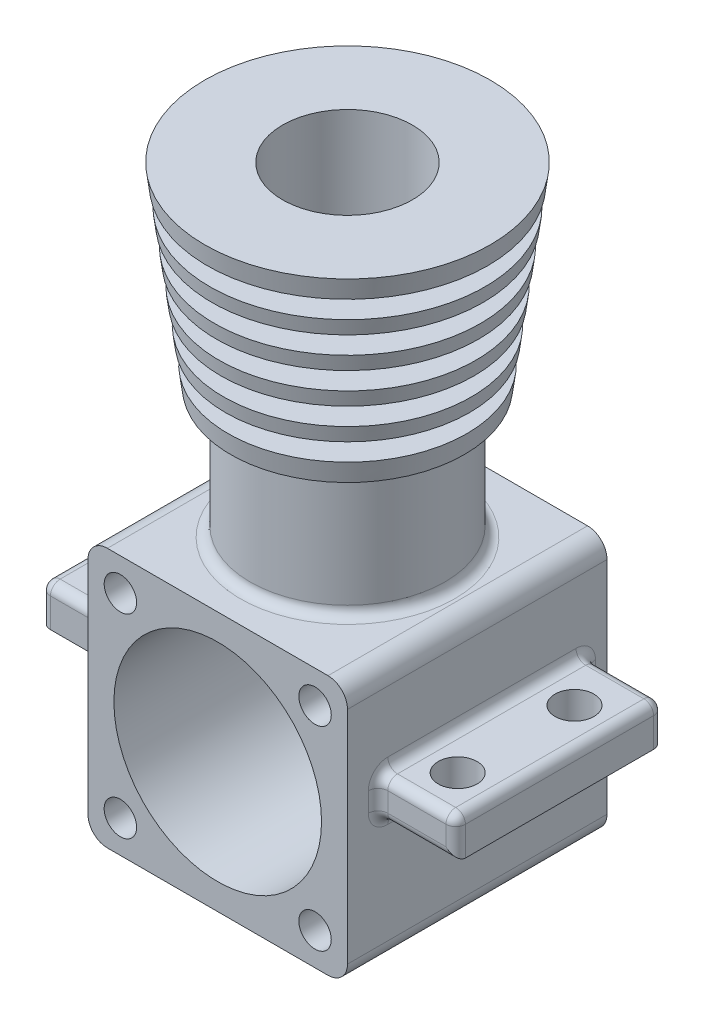
from build123d import *

# Parameters (mm, degrees)
SKETCH1_W           = 40
SKETCH1_H           = 40
SKETCH1_R           = 2.5
SKETCH1_R_2         = 16
BOSS_EXTRUDE1_DEPTH = 20
FILLET2_R           = 3
SKETCH7_W           = 18
SKETCH7_H           = 3
LPATTERN1_COUNT     = 5
LPATTERN1_PITCH     = 5.25
SKETCH8_R           = 10
CUT_EXTRUDE1_DEPTH  = 70
SKETCH10_W          = 12
SKETCH10_H          = 32
SKETCH10_R          = 3
BOSS_EXTRUDE2_DEPTH = 6
FILLET4_R           = 1.5


with BuildPart() as part:
    # Sketch1 → Boss-Extrude1 (new, symmetric)
    with BuildSketch(Plane.XY):
        with Locations((0.017734769, -0.034630907)):
            Rectangle(SKETCH1_W, SKETCH1_H)
        with Locations((-14.982265231, 14.965369093)):
            Circle(SKETCH1_R, mode=Mode.SUBTRACT)
        with Locations((15.017734769, 14.965369093)):
            Circle(SKETCH1_R, mode=Mode.SUBTRACT)
        with Locations((15.017734769, -15.034630907)):
            Circle(SKETCH1_R, mode=Mode.SUBTRACT)
        with Locations((-14.982265231, -15.034630907)):
            Circle(SKETCH1_R, mode=Mode.SUBTRACT)
        with Locations((0.017734769, -0.034630907)):
            Circle(SKETCH1_R_2, mode=Mode.SUBTRACT)
    extrude(amount=BOSS_EXTRUDE1_DEPTH, both=True)

    # Fillet2
    fillet2_edges = [part.edges().sort_by_distance(p)[0] for p in [
        (20.017734769, -20.034630907, 0),
        (-19.982265231, -20.034630907, 0),
        (20.017734769, 19.965369093, 0),
        (-19.982265231, 19.965369093, 0),
    ]]
    fillet(fillet2_edges, radius=FILLET2_R)

    # Sketch2 → Revolve2 (revolve)
    with BuildSketch(Plane.XY):
        Polygon((0.017734769, 19.965369093), (0.017734769, 69.965369093), (-21.982265231, 69.965369093), (-17.982265231, 39.965369093), (-14.982265231, 39.965369093), (-14.982265231, 19.965369093), align=None)
    revolve(axis=Axis((0.017734769, 19.965369093, 0), (0, 1, 0)))

    # Sketch7 → Cut-Revolve3 (revolve, cut)
    with BuildSketch(Plane.XY):
        with Locations((-20.982265231, 44.465369093)):
            Rectangle(SKETCH7_W, SKETCH7_H)
    cut_revolve3 = revolve(axis=Axis((0.017734769, 42.965369093, 0), (0, 1, 0)), mode=Mode.SUBTRACT)

    # LPattern1: Cut-Revolve3 ×5
    with Locations(*[(0, i * LPATTERN1_PITCH, 0) for i in range(1, LPATTERN1_COUNT)]):
        add(cut_revolve3, mode=Mode.SUBTRACT)

    # Sketch8 → Cut-Extrude1 (cut)
    with BuildSketch(Plane(origin=(0, 69.965369093, 0), x_dir=(1, 0, 0), z_dir=(0, 1, 0))):
        with Locations((0.017734769, 0)):
            Circle(SKETCH8_R)
    extrude(amount=-CUT_EXTRUDE1_DEPTH, mode=Mode.SUBTRACT)

    # Sketch10 → Boss-Extrude2 (add)
    with BuildSketch(Plane(origin=(0, 0, 0), x_dir=(1, 0, 0), z_dir=(0, 1, 0))):
        with Locations((-25.982265231, 0.712845565)):
            Rectangle(SKETCH10_W, SKETCH10_H)
        with Locations((-26, -9)):
            Circle(SKETCH10_R, mode=Mode.SUBTRACT)
        with Locations((-26, 9)):
            Circle(SKETCH10_R, mode=Mode.SUBTRACT)
    boss_extrude2 = extrude(amount=BOSS_EXTRUDE2_DEPTH)

    # Mirror1: Boss-Extrude2 across plane
    add(boss_extrude2.mirror(Plane(origin=(0, 0, 0), x_dir=(0, 0, 1), z_dir=(1, 0, 0))))

    # Fillet4
    fillet4_edges = [part.edges().sort_by_distance(p)[0] for p in [
        (20.017734769, 0, -0.712845565),
        (20.017734769, 6, -0.712845565),
        (20.017734769, 3, 15.287154435),
        (26, 0, 15.287154435),
        (20.017734769, 3, -16.712845565),
        (31.982265231, 3, 15.287154435),
        (31.982265231, 3, -16.712845565),
        (26, 6, -16.712845565),
        (31.982265231, 6, -0.712845565),
        (26, 6, 15.287154435),
        (15.017734769, 19.965369093, 0),
        (-19.982265231, 6, -0.712845565),
        (-19.982265231, 3, -16.712845565),
        (-31.982265231, 3, -16.712845565),
        (-19.982265231, 3, 15.287154435),
        (-31.982265231, 3, 15.287154435),
        (-25.982265231, 6, -16.712845565),
        (-25.982265231, 6, 15.287154435),
        (-31.982265231, 6, -0.712845565),
    ]]
    fillet(fillet4_edges, radius=FILLET4_R)


solid = part.part
